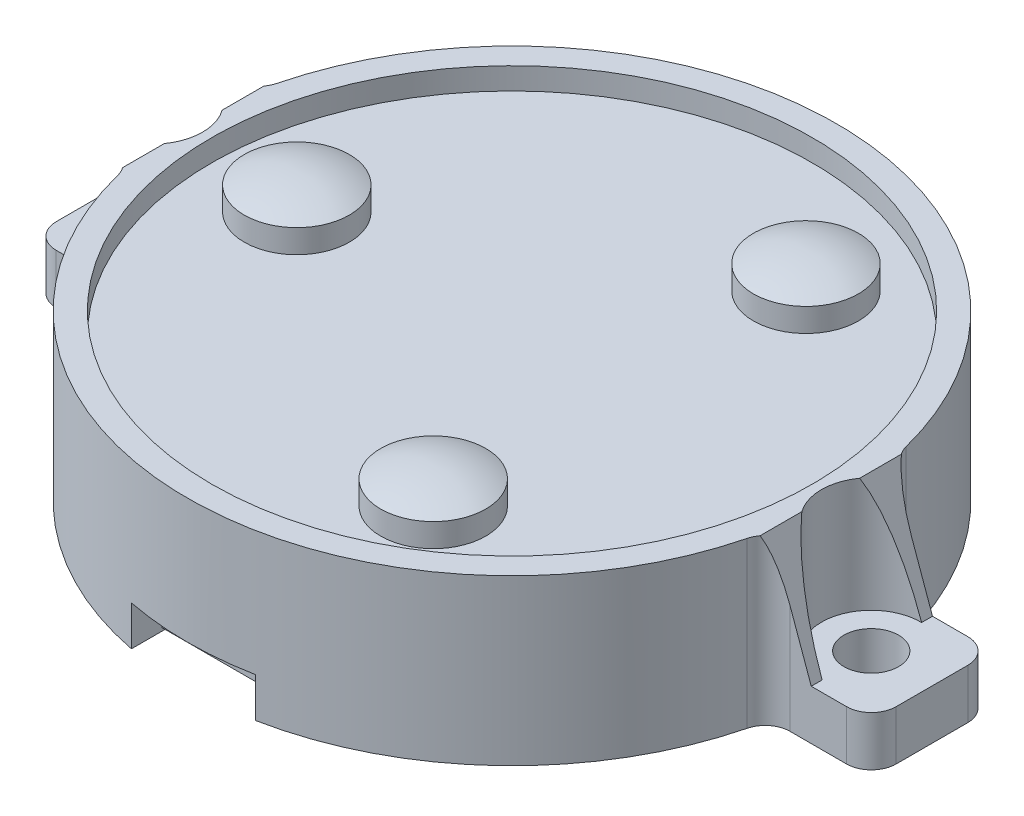
from build123d import *

# Parameters (mm, degrees)
SKETCH1_R                      = 15.35
BOSS_EXTRUDE1_DEPTH            = 2.71
SKETCH2_R                      = 2.685
BOSS_EXTRUDE2_DEPTH            = 1.2
DOME1_FACE_RADIUS              = 2.685
DOME1_HEIGHT                   = 0.6
CIRPATTERN1_COUNT              = 3
CIRPATTERN1_COPY_1_FACE_RADIUS = 2.685
CIRPATTERN1_COPY_1_HEIGHT      = 0.6
CIRPATTERN1_COPY_2_FACE_RADIUS = 2.685
CIRPATTERN1_COPY_2_HEIGHT      = 0.6
BOSS_EXTRUDE3_START            = 2.55
SKETCH3_W                      = 5.5
SKETCH3_H                      = 4.2
SKETCH3_W_2                    = 1.5
SKETCH3_H_2                    = 2.8
BOSS_EXTRUDE3_DEPTH            = 2.55
SKETCH4_W                      = 5.5
SKETCH4_H                      = 4.2
BOSS_EXTRUDE4_DEPTH            = 1.44
CHIP_DEPTH                     = 1.7018
BOSS_EXTRUDE5_DEPTH            = 2.032
BOSS_EXTRUDE6_START            = 6.37794
SKETCH7_R                      = 16.5862
SKETCH7_R_2                    = 15.35
BOSS_EXTRUDE6_DEPTH            = 6.37794
BOSS_EXTRUDE7_START            = -8.40994
SKETCH8_R                      = 1.397
BOSS_EXTRUDE7_DEPTH            = 8.40994
SKETCH9_R                      = 2.5443
CUT_EXTRUDE1_DEPTH             = 5.86994
CUT_EXTRUDE4_REACH             = 31.486
FILLET1_R                      = 1.27


with BuildPart() as part:
    # Sketch1 → Boss-Extrude1 (new body)
    with BuildSketch(Plane(origin=(0, 0, 0), x_dir=(1, 0, 0), z_dir=(0, 1, 0))):
        with Locations(Location((0, 0, 0), (0, 0, 270))):
            Circle(SKETCH1_R)
    extrude(amount=BOSS_EXTRUDE1_DEPTH)

    # Sketch2 → Boss-Extrude2 (add)
    with BuildSketch(Plane(origin=(0, 2.71, 0), x_dir=(-1, 0, 0), z_dir=(0, 1, 0))):
        with Locations(Location((-5.5, 9.526279442, 0), (0, 0, 90))):
            Circle(SKETCH2_R)
    boss_extrude2 = extrude(amount=BOSS_EXTRUDE2_DEPTH)

    # Dome1: a dome of height H over a round flat face of radius A is a cap of a sphere of radius (A * A + H * H) / (2 * H)
    dome1_r = (DOME1_FACE_RADIUS * DOME1_FACE_RADIUS + DOME1_HEIGHT * DOME1_HEIGHT) / (2 * DOME1_HEIGHT)
    dome1_base = Plane((5.5, 3.91, 9.526279442), z_dir=(0, 1, 0))
    with Locations(dome1_base.offset(DOME1_HEIGHT - dome1_r)):
        dome1_ball = Sphere(dome1_r, mode=Mode.PRIVATE)
    add(split(dome1_ball, bisect_by=dome1_base, keep=Keep.TOP, mode=Mode.PRIVATE))

    # CirPattern1: Boss-Extrude2 ×3 about axis
    cirpattern1_axis = Axis((0, 0, 0), (0, 1, 0))
    for i in range(1, CIRPATTERN1_COUNT):
        add(boss_extrude2.rotate(cirpattern1_axis, i * 360 / CIRPATTERN1_COUNT))

    # CirPattern1 copy 1: a dome of height H over a round flat face of radius A is a cap of a sphere of radius (A * A + H * H) / (2 * H)
    cirpattern1_copy_1_r = (CIRPATTERN1_COPY_1_FACE_RADIUS * CIRPATTERN1_COPY_1_FACE_RADIUS + CIRPATTERN1_COPY_1_HEIGHT * CIRPATTERN1_COPY_1_HEIGHT) / (2 * CIRPATTERN1_COPY_1_HEIGHT)
    cirpattern1_copy_1_base = Plane((5.5, 3.91, -9.526279442), z_dir=(0, 1, 0))
    with Locations(cirpattern1_copy_1_base.offset(CIRPATTERN1_COPY_1_HEIGHT - cirpattern1_copy_1_r)):
        cirpattern1_copy_1_ball = Sphere(cirpattern1_copy_1_r, mode=Mode.PRIVATE)
    add(split(cirpattern1_copy_1_ball, bisect_by=cirpattern1_copy_1_base, keep=Keep.TOP, mode=Mode.PRIVATE))

    # CirPattern1 copy 2: a dome of height H over a round flat face of radius A is a cap of a sphere of radius (A * A + H * H) / (2 * H)
    cirpattern1_copy_2_r = (CIRPATTERN1_COPY_2_FACE_RADIUS * CIRPATTERN1_COPY_2_FACE_RADIUS + CIRPATTERN1_COPY_2_HEIGHT * CIRPATTERN1_COPY_2_HEIGHT) / (2 * CIRPATTERN1_COPY_2_HEIGHT)
    cirpattern1_copy_2_base = Plane((-11, 3.91, 0), z_dir=(0, 1, 0))
    with Locations(cirpattern1_copy_2_base.offset(CIRPATTERN1_COPY_2_HEIGHT - cirpattern1_copy_2_r)):
        cirpattern1_copy_2_ball = Sphere(cirpattern1_copy_2_r, mode=Mode.PRIVATE)
    add(split(cirpattern1_copy_2_ball, bisect_by=cirpattern1_copy_2_base, keep=Keep.TOP, mode=Mode.PRIVATE))

    # Sketch3 → Boss-Extrude3 (add)
    with BuildSketch(Plane.XZ.offset(BOSS_EXTRUDE3_START)):
        with Locations((0, 13.05)):
            Rectangle(SKETCH3_W, SKETCH3_H)
        with Locations((0, -13.05)):
            Rectangle(SKETCH3_W, SKETCH3_H)
        with Locations((3.5, 13.05)):
            Rectangle(SKETCH3_W_2, SKETCH3_H_2)
        with Locations((-3.5, 13.05)):
            Rectangle(SKETCH3_W_2, SKETCH3_H_2)
        with Locations((3.5, -13.05)):
            Rectangle(SKETCH3_W_2, SKETCH3_H_2)
        with Locations((-3.5, -13.05)):
            Rectangle(SKETCH3_W_2, SKETCH3_H_2)
        with BuildLine():
            Line((2.75, 15.101655538), (2.75, 15.15))
            Line((2.75, 15.15), (2.469817807, 15.15))
            ThreePointArc((2.469817807, 15.15), (2.610020839, 15.126476497), (2.75, 15.101655538))
        make_face()
        with BuildLine():
            ThreePointArc((-2.75, 15.101655538), (-2.610020839, 15.126476497), (-2.469817807, 15.15))
            Line((-2.469817807, 15.15), (-2.75, 15.15))
            Line((-2.75, 15.15), (-2.75, 15.101655538))
        make_face()
        with BuildLine():
            ThreePointArc((-2.469817807, -15.15), (-2.610020839, -15.126476497), (-2.75, -15.101655538))
            Line((-2.75, -15.101655538), (-2.75, -15.15))
            Line((-2.75, -15.15), (-2.469817807, -15.15))
        make_face()
        with BuildLine():
            Line((2.75, -15.15), (2.75, -15.101655538))
            ThreePointArc((2.75, -15.101655538), (2.610020839, -15.126476497), (2.469817807, -15.15))
            Line((2.469817807, -15.15), (2.75, -15.15))
        make_face()
    extrude(amount=-BOSS_EXTRUDE3_DEPTH)

    # Sketch4 → Boss-Extrude4 (add)
    with BuildSketch(Plane.XZ.offset(2.55)):
        Polygon((-2.75, 10.95), (2.75, 10.95), (2.75, 11.65), (2.75, 14.45), (2.75, 15.15), (-2.75, 15.15), (-2.75, 14.45), (-2.75, 11.65), align=None)
        with Locations((0, -13.05)):
            Rectangle(SKETCH4_W, SKETCH4_H)
    extrude(amount=BOSS_EXTRUDE4_DEPTH)

    # Sketch5 → Chip (add)
    with BuildSketch(Plane.XZ):
        Polygon((-5.1644, -9.425953844), (-2.016601499, -2.878979584), (-8.014179317, 0.004667994), (-11.161977818, -6.542306266), align=None)
    extrude(amount=CHIP_DEPTH)

    # Sketch6 → Boss-Extrude5 (add)
    with BuildSketch(Plane.XZ.offset(2.55)):
        with BuildLine():
            Line((-3.175, 16.279478046), (-3.175, 10.525))
            Line((-3.175, 10.525), (3.175, 10.525))
            Line((3.175, 10.525), (3.175, 16.279478046))
            ThreePointArc((3.175, 16.279478046), (16.5862, 0), (3.175, -16.279478046))
            Line((3.175, -16.279478046), (3.175, -10.525))
            Line((3.175, -10.525), (-3.175, -10.525))
            Line((-3.175, -10.525), (-3.175, -16.279478046))
            ThreePointArc((-3.175, -16.279478046), (-16.5862, 0), (-3.175, 16.279478046))
        make_face()
    extrude(amount=BOSS_EXTRUDE5_DEPTH)

    # Sketch7 → Boss-Extrude6 (add)
    with BuildSketch(Plane(origin=(0, -2.55, 0), x_dir=(1, 0, 0), z_dir=(0, 1, 0)).offset(BOSS_EXTRUDE6_START)):
        with Locations(Location((0, 0, 0), (0, 0, 270))):
            Circle(SKETCH7_R)
        with Locations(Location((0, 0, 0), (0, 0, 270))):
            Circle(SKETCH7_R_2, mode=Mode.SUBTRACT)
    extrude(amount=-BOSS_EXTRUDE6_DEPTH)

    # Sketch8 → Boss-Extrude7 (add)
    # profile 1 of 2: a face of its own
    with BuildSketch(Plane.XZ.offset(4.582).offset(BOSS_EXTRUDE7_START)):
        with BuildLine():
            ThreePointArc((-16.294154443, -3.0988), (-16.5862, 0), (-16.294154443, 3.0988))
            Line((-16.294154443, 3.0988), (-21.46935, 3.0988))
            Line((-21.46935, 3.0988), (-21.46935, -3.0988))
            Line((-21.46935, -3.0988), (-16.294154443, -3.0988))
        make_face()
        with Locations(Location((-18.3642, 0, 0), (0, 0, 270))):
            Circle(SKETCH8_R, mode=Mode.SUBTRACT)
    # profile 2 of 2: a face of its own
    with BuildSketch(Plane.XZ.offset(4.582).offset(BOSS_EXTRUDE7_START)):
        with BuildLine():
            Line((21.46935, 3.0988), (16.294154443, 3.0988))
            ThreePointArc((16.294154443, 3.0988), (16.5862, 0), (16.294154443, -3.0988))
            Line((16.294154443, -3.0988), (21.46935, -3.0988))
            Line((21.46935, -3.0988), (21.46935, 3.0988))
        make_face()
        with Locations(Location((18.3642, 0, 0), (0, 0, 270))):
            Circle(SKETCH8_R, mode=Mode.SUBTRACT)
    extrude(amount=BOSS_EXTRUDE7_DEPTH)

    # Sketch9 → Cut-Extrude1 (cut)
    with BuildSketch(Plane(origin=(0, 3.82794, 0), x_dir=(1, 0, 0), z_dir=(0, 1, 0))):
        with Locations(Location((-18.3642, 0, 0), (0, 0, 270))):
            Circle(SKETCH9_R)
    cut_extrude1 = extrude(amount=-CUT_EXTRUDE1_DEPTH, mode=Mode.SUBTRACT)

    # Cut-Extrude4: up to this face of the body (flat: up to its plane)
    cut_extrude4_end = Plane(part.part.faces().sort_by_distance((-18.881752221, -0.37703, -3.0988))[0])
    # Sketch10 → Cut-Extrude4 (cut, up to the picked face)
    with BuildSketch(Plane.XY.offset(3.0988), mode=Mode.PRIVATE) as cut_extrude4_sk1:
        Polygon((-21.46935, -2.042), (-18.39595, -2.042), (-16.294154443, 3.82794), (-21.46935, 3.82794), align=None)
    cut_extrude4_tool1 = split(extrude(cut_extrude4_sk1.sketch, amount=-CUT_EXTRUDE4_REACH, mode=Mode.PRIVATE), bisect_by=cut_extrude4_end, keep=Keep.BOTH, mode=Mode.PRIVATE)
    cut_extrude4 = cut_extrude4_tool1.solids().sort_by(Axis((-19.362572, 1.142253, 3.0988), (0, 0, -1)))[0]
    add(cut_extrude4, mode=Mode.SUBTRACT)

    # Mirror2: Cut-Extrude1, Cut-Extrude4 across plane
    add(cut_extrude1.mirror(Plane(origin=(0, 0, 0), x_dir=(0, 0, 1), z_dir=(1, 0, 0))), mode=Mode.SUBTRACT)
    add(cut_extrude4.mirror(Plane(origin=(0, 0, 0), x_dir=(0, 0, 1), z_dir=(1, 0, 0))), mode=Mode.SUBTRACT)

    # Fillet1
    fillet1_edges = [part.edges().sort_by_distance(p)[0] for p in [
        (16.294154443, -0.37703, -3.0988),
        (16.294154443, -0.37703, 3.0988),
        (-16.294154443, 0.63897, -3.0988),
        (-16.294154443, 0.63897, 3.0988),
        (-21.46935, -3.312, 3.0988),
        (-21.46935, -3.312, -3.0988),
        (21.46935, -3.312, 3.0988),
        (21.46935, -3.312, -3.0988),
    ]]
    fillet(fillet1_edges, radius=FILLET1_R)


solid = part.part
